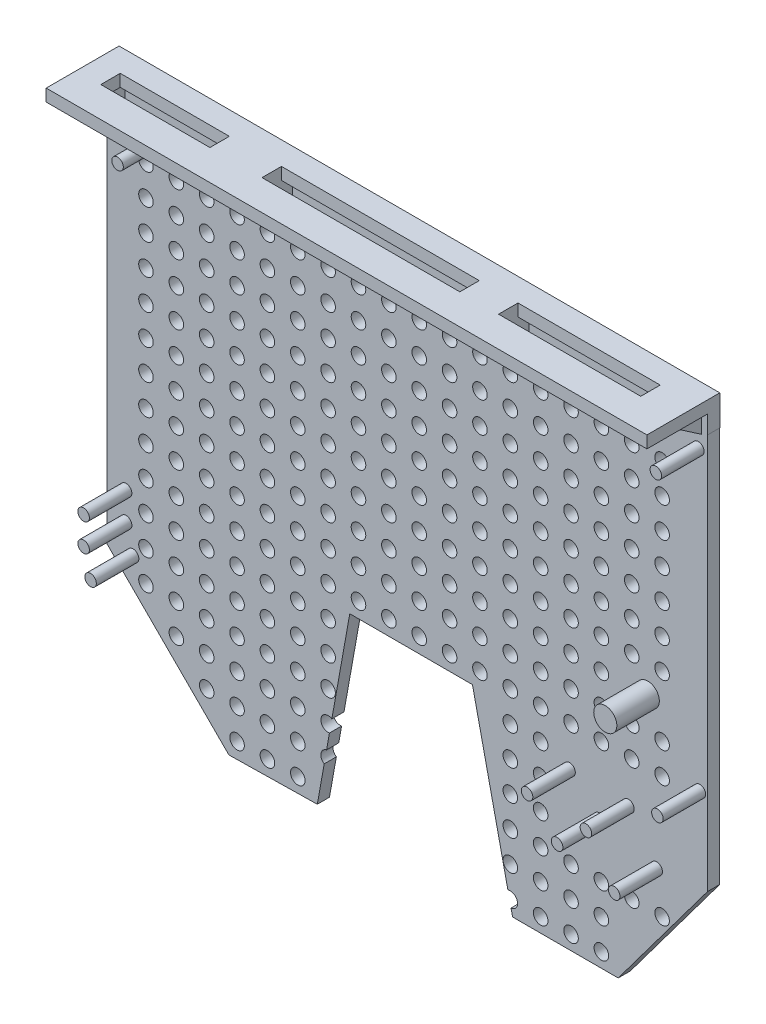
from build123d import *

# Parameters (mm, degrees)
EXTRUDE_1_DEPTH          = 2
SKETCH_2_R               = 0.95
SKETCH_2_R_2             = 1.9
EXTRUDE_2_DEPTH          = 9
SKETCH_3_W               = 98.928997638
SKETCH_3_H               = 5
EXTRUDE_3_DEPTH          = 2
SKETCH_4_W               = 98.928997638
SKETCH_4_H               = 2
EXTRUDE_4_DEPTH          = 12
CUT_EXTRUDE_3_REACH      = 116.614
SKETCH_6_W               = 32.578502253
SKETCH_6_H               = 3.2
SKETCH_6_W_2             = 23.419421548
SKETCH_6_W_3             = 17.970348218
CUT_EXTRUDE_6_DEPTH      = 97.263459093
CUT_EXTRUDE_6_DEPTH_BACK = 97.263459093
SKETCH_8_R               = 1.2
RIB_11_REACH             = 121.052
SKETCH_11_WALL_W         = 246.164501964
SKETCH_11_WALL_H         = 3
RIB_13_REACH             = 97.201
SKETCH_12_WALL_W         = 198.463511168
SKETCH_12_WALL_H         = 7
RIB_14_REACH             = 98.001
SKETCH_13_WALL_W         = 200.062147334
SKETCH_13_WALL_H         = 6
RIB_33_REACH             = 116.104
SKETCH_15_WALL_W         = 236.268757542
SKETCH_15_WALL_H         = 5


with BuildPart() as part:
    # 草图1 → 凸台-拉伸1 (new body)
    with BuildSketch(Plane.XY):
        Polygon((-29.070358141, -45.048209124), (-8.984674058, -65.133893207), (5.577379704, -64.884429769), (10.922021844, -35.039370079), (31.127475009, -35.049384298), (37.731775464, -64.884429769), (55.12709051, -64.88814952), (69.839329163, -45.20535212), (69.839329163, 19.933959868), (-29.070358141, 19.933959868), align=None)
    extrude(amount=EXTRUDE_1_DEPTH)

    # 草图2 → 凸台-拉伸2 (add)
    with BuildSketch(Plane.XY):
        with Locations(Location((-20.32004064, 17.018034036, 0), (0, 0, 180))):
            Circle(SKETCH_2_R)
        with Locations(Location((68.326136652, 17.272034544, 0), (0, 0, 180))):
            Circle(SKETCH_2_R)
        with Locations(Location((60.00011938, -22.00004318, 0), (0, 0, 180))):
            Circle(SKETCH_2_R_2)
        with Locations(Location((68.58013716, -31.496062992, 0), (0, 0, 180))):
            Circle(SKETCH_2_R)
        with Locations(Location((-25.908051816, -35.814071628, 0), (0, 0, 180))):
            Circle(SKETCH_2_R)
        with Locations(Location((-25.908051816, -40.386080772, 0), (0, 0, 180))):
            Circle(SKETCH_2_R)
        with Locations(Location((-24.76504953, -44.577089154, 0), (0, 0, 180))):
            Circle(SKETCH_2_R)
        with Locations(Location((56.811457963, -39.497078994, 0), (0, 0, 180))):
            Circle(SKETCH_2_R)
        with Locations(Location((47.117094234, -39.116078232, 0), (0, 0, 180))):
            Circle(SKETCH_2_R)
        with Locations(Location((52.07010414, -43.81508763, 0), (0, 0, 180))):
            Circle(SKETCH_2_R)
        with Locations(Location((61.468122936, -46.101092202, 0), (0, 0, 180))):
            Circle(SKETCH_2_R)
    extrude(amount=EXTRUDE_2_DEPTH)

    # 草图3 → 凸台-拉伸3 (add)
    with BuildSketch(Plane.XY):
        with Locations((20.394140678, 22.433959868)):
            Rectangle(SKETCH_3_W, SKETCH_3_H)
    extrude(amount=EXTRUDE_3_DEPTH)

    # 草图4 → 凸台-拉伸4 (add)
    with BuildSketch(Plane.XY):
        with Locations((20.394140678, 23.933959868)):
            Rectangle(SKETCH_4_W, SKETCH_4_H)
    extrude(amount=EXTRUDE_4_DEPTH)

    # 草图6 → 切除-拉伸3 (cut, up to next)
    with BuildSketch(Plane(origin=(0, 24.933959868, 0), x_dir=(1, 0, 0), z_dir=(0, 1, 0)), mode=Mode.PRIVATE) as cut_extrude_3_sk1:
        with Locations((17.760055682, -5.4)):
            Rectangle(SKETCH_6_W, SKETCH_6_H)
    cut_extrude_3_tool1 = extrude(cut_extrude_3_sk1.sketch, amount=-CUT_EXTRUDE_3_REACH, mode=Mode.PRIVATE) & part.part
    # 草图6 → 切除-拉伸3 (cut, up to next)
    with BuildSketch(Plane(origin=(0, 24.933959868, 0), x_dir=(1, 0, 0), z_dir=(0, 1, 0)), mode=Mode.PRIVATE) as cut_extrude_3_sk2:
        with Locations((52.135592757, -5.4)):
            Rectangle(SKETCH_6_W_2, SKETCH_6_H)
    cut_extrude_3_tool2 = extrude(cut_extrude_3_sk2.sketch, amount=-CUT_EXTRUDE_3_REACH, mode=Mode.PRIVATE) & part.part
    # 草图6 → 切除-拉伸3 (cut, up to next)
    with BuildSketch(Plane(origin=(0, 24.933959868, 0), x_dir=(1, 0, 0), z_dir=(0, 1, 0)), mode=Mode.PRIVATE) as cut_extrude_3_sk3:
        with Locations((-16.093761605, -5.4)):
            Rectangle(SKETCH_6_W_3, SKETCH_6_H)
    cut_extrude_3_tool3 = extrude(cut_extrude_3_sk3.sketch, amount=-CUT_EXTRUDE_3_REACH, mode=Mode.PRIVATE) & part.part
    add(cut_extrude_3_tool1.solids().sort_by_distance((17.760056, 24.93396, 5.4))[0], mode=Mode.SUBTRACT)
    add(cut_extrude_3_tool2.solids().sort_by_distance((52.135593, 24.93396, 5.4))[0], mode=Mode.SUBTRACT)
    add(cut_extrude_3_tool3.solids().sort_by_distance((-16.093762, 24.93396, 5.4))[0], mode=Mode.SUBTRACT)

    # 草图8 → 切除-拉伸6 (cut, two sides: drawn at the far end of the back side and taken through both)
    with BuildSketch(Plane.XY.offset(-CUT_EXTRUDE_6_DEPTH_BACK)):
        with Locations((-12.641748506, 17.458409182)):
            Circle(SKETCH_8_R)
        with Locations((-7.641748506, 17.458409182)):
            Circle(SKETCH_8_R)
        with Locations((-2.641748506, 17.458409182)):
            Circle(SKETCH_8_R)
        with Locations((2.358251494, 17.458409182)):
            Circle(SKETCH_8_R)
        with Locations((7.358251494, 17.458409182)):
            Circle(SKETCH_8_R)
        with Locations((12.358251494, 17.458409182)):
            Circle(SKETCH_8_R)
        with Locations((17.358251494, 17.458409182)):
            Circle(SKETCH_8_R)
        with Locations((22.358251494, 17.458409182)):
            Circle(SKETCH_8_R)
        with Locations((27.358251494, 17.458409182)):
            Circle(SKETCH_8_R)
        with Locations((32.358251494, 17.458409182)):
            Circle(SKETCH_8_R)
        with Locations((37.358251494, 17.458409182)):
            Circle(SKETCH_8_R)
        with Locations((42.358251494, 17.458409182)):
            Circle(SKETCH_8_R)
        with Locations((47.358251494, 17.458409182)):
            Circle(SKETCH_8_R)
        with Locations((52.358251494, 17.458409182)):
            Circle(SKETCH_8_R)
        with Locations((57.358251494, 17.458409182)):
            Circle(SKETCH_8_R)
        with Locations((62.358251494, 17.458409182)):
            Circle(SKETCH_8_R)
        with Locations((-17.641748506, 12.458409182)):
            Circle(SKETCH_8_R)
        with Locations((-12.641748506, 12.458409182)):
            Circle(SKETCH_8_R)
        with Locations((-7.641748506, 12.458409182)):
            Circle(SKETCH_8_R)
        with Locations((-2.641748506, 12.458409182)):
            Circle(SKETCH_8_R)
        with Locations((2.358251494, 12.458409182)):
            Circle(SKETCH_8_R)
        with Locations((7.358251494, 12.458409182)):
            Circle(SKETCH_8_R)
        with Locations((12.358251494, 12.458409182)):
            Circle(SKETCH_8_R)
        with Locations((17.358251494, 12.458409182)):
            Circle(SKETCH_8_R)
        with Locations((22.358251494, 12.458409182)):
            Circle(SKETCH_8_R)
        with Locations((27.358251494, 12.458409182)):
            Circle(SKETCH_8_R)
        with Locations((32.358251494, 12.458409182)):
            Circle(SKETCH_8_R)
        with Locations((37.358251494, 12.458409182)):
            Circle(SKETCH_8_R)
        with Locations((42.358251494, 12.458409182)):
            Circle(SKETCH_8_R)
        with Locations((47.358251494, 12.458409182)):
            Circle(SKETCH_8_R)
        with Locations((52.358251494, 12.458409182)):
            Circle(SKETCH_8_R)
        with Locations((57.358251494, 12.458409182)):
            Circle(SKETCH_8_R)
        with Locations((62.358251494, 12.458409182)):
            Circle(SKETCH_8_R)
        with Locations((-17.641748506, 7.458409182)):
            Circle(SKETCH_8_R)
        with Locations((-12.641748506, 7.458409182)):
            Circle(SKETCH_8_R)
        with Locations((-7.641748506, 7.458409182)):
            Circle(SKETCH_8_R)
        with Locations((-2.641748506, 7.458409182)):
            Circle(SKETCH_8_R)
        with Locations((2.358251494, 7.458409182)):
            Circle(SKETCH_8_R)
        with Locations((7.358251494, 7.458409182)):
            Circle(SKETCH_8_R)
        with Locations((12.358251494, 7.458409182)):
            Circle(SKETCH_8_R)
        with Locations((17.358251494, 7.458409182)):
            Circle(SKETCH_8_R)
        with Locations((22.358251494, 7.458409182)):
            Circle(SKETCH_8_R)
        with Locations((27.358251494, 7.458409182)):
            Circle(SKETCH_8_R)
        with Locations((32.358251494, 7.458409182)):
            Circle(SKETCH_8_R)
        with Locations((37.358251494, 7.458409182)):
            Circle(SKETCH_8_R)
        with Locations((42.358251494, 7.458409182)):
            Circle(SKETCH_8_R)
        with Locations((47.358251494, 7.458409182)):
            Circle(SKETCH_8_R)
        with Locations((52.358251494, 7.458409182)):
            Circle(SKETCH_8_R)
        with Locations((57.358251494, 7.458409182)):
            Circle(SKETCH_8_R)
        with Locations((62.358251494, 7.458409182)):
            Circle(SKETCH_8_R)
        with Locations((-17.641748506, 2.458409182)):
            Circle(SKETCH_8_R)
        with Locations((-12.641748506, 2.458409182)):
            Circle(SKETCH_8_R)
        with Locations((-7.641748506, 2.458409182)):
            Circle(SKETCH_8_R)
        with Locations((-2.641748506, 2.458409182)):
            Circle(SKETCH_8_R)
        with Locations((2.358251494, 2.458409182)):
            Circle(SKETCH_8_R)
        with Locations((7.358251494, 2.458409182)):
            Circle(SKETCH_8_R)
        with Locations((12.358251494, 2.458409182)):
            Circle(SKETCH_8_R)
        with Locations((17.358251494, 2.458409182)):
            Circle(SKETCH_8_R)
        with Locations((22.358251494, 2.458409182)):
            Circle(SKETCH_8_R)
        with Locations((27.358251494, 2.458409182)):
            Circle(SKETCH_8_R)
        with Locations((32.358251494, 2.458409182)):
            Circle(SKETCH_8_R)
        with Locations((37.358251494, 2.458409182)):
            Circle(SKETCH_8_R)
        with Locations((42.358251494, 2.458409182)):
            Circle(SKETCH_8_R)
        with Locations((47.358251494, 2.458409182)):
            Circle(SKETCH_8_R)
        with Locations((52.358251494, 2.458409182)):
            Circle(SKETCH_8_R)
        with Locations((57.358251494, 2.458409182)):
            Circle(SKETCH_8_R)
        with Locations((62.358251494, 2.458409182)):
            Circle(SKETCH_8_R)
        with Locations((-17.641748506, -2.541590818)):
            Circle(SKETCH_8_R)
        with Locations((-12.641748506, -2.541590818)):
            Circle(SKETCH_8_R)
        with Locations((-7.641748506, -2.541590818)):
            Circle(SKETCH_8_R)
        with Locations((-2.641748506, -2.541590818)):
            Circle(SKETCH_8_R)
        with Locations((2.358251494, -2.541590818)):
            Circle(SKETCH_8_R)
        with Locations((7.358251494, -2.541590818)):
            Circle(SKETCH_8_R)
        with Locations((12.358251494, -2.541590818)):
            Circle(SKETCH_8_R)
        with Locations((17.358251494, -2.541590818)):
            Circle(SKETCH_8_R)
        with Locations((22.358251494, -2.541590818)):
            Circle(SKETCH_8_R)
        with Locations((27.358251494, -2.541590818)):
            Circle(SKETCH_8_R)
        with Locations((32.358251494, -2.541590818)):
            Circle(SKETCH_8_R)
        with Locations((37.358251494, -2.541590818)):
            Circle(SKETCH_8_R)
        with Locations((42.358251494, -2.541590818)):
            Circle(SKETCH_8_R)
        with Locations((47.358251494, -2.541590818)):
            Circle(SKETCH_8_R)
        with Locations((52.358251494, -2.541590818)):
            Circle(SKETCH_8_R)
        with Locations((57.358251494, -2.541590818)):
            Circle(SKETCH_8_R)
        with Locations((62.358251494, -2.541590818)):
            Circle(SKETCH_8_R)
        with Locations((-17.641748506, -7.541590818)):
            Circle(SKETCH_8_R)
        with Locations((-12.641748506, -7.541590818)):
            Circle(SKETCH_8_R)
        with Locations((-7.641748506, -7.541590818)):
            Circle(SKETCH_8_R)
        with Locations((-2.641748506, -7.541590818)):
            Circle(SKETCH_8_R)
        with Locations((2.358251494, -7.541590818)):
            Circle(SKETCH_8_R)
        with Locations((7.358251494, -7.541590818)):
            Circle(SKETCH_8_R)
        with Locations((12.358251494, -7.541590818)):
            Circle(SKETCH_8_R)
        with Locations((17.358251494, -7.541590818)):
            Circle(SKETCH_8_R)
        with Locations((22.358251494, -7.541590818)):
            Circle(SKETCH_8_R)
        with Locations((27.358251494, -7.541590818)):
            Circle(SKETCH_8_R)
        with Locations((32.358251494, -7.541590818)):
            Circle(SKETCH_8_R)
        with Locations((37.358251494, -7.541590818)):
            Circle(SKETCH_8_R)
        with Locations((42.358251494, -7.541590818)):
            Circle(SKETCH_8_R)
        with Locations((47.358251494, -7.541590818)):
            Circle(SKETCH_8_R)
        with Locations((52.358251494, -7.541590818)):
            Circle(SKETCH_8_R)
        with Locations((57.358251494, -7.541590818)):
            Circle(SKETCH_8_R)
        with Locations((62.358251494, -7.541590818)):
            Circle(SKETCH_8_R)
        with Locations((-17.641748506, -12.541590818)):
            Circle(SKETCH_8_R)
        with Locations((-12.641748506, -12.541590818)):
            Circle(SKETCH_8_R)
        with Locations((-7.641748506, -12.541590818)):
            Circle(SKETCH_8_R)
        with Locations((-2.641748506, -12.541590818)):
            Circle(SKETCH_8_R)
        with Locations((2.358251494, -12.541590818)):
            Circle(SKETCH_8_R)
        with Locations((7.358251494, -12.541590818)):
            Circle(SKETCH_8_R)
        with Locations((12.358251494, -12.541590818)):
            Circle(SKETCH_8_R)
        with Locations((17.358251494, -12.541590818)):
            Circle(SKETCH_8_R)
        with Locations((22.358251494, -12.541590818)):
            Circle(SKETCH_8_R)
        with Locations((27.358251494, -12.541590818)):
            Circle(SKETCH_8_R)
        with Locations((32.358251494, -12.541590818)):
            Circle(SKETCH_8_R)
        with Locations((37.358251494, -12.541590818)):
            Circle(SKETCH_8_R)
        with Locations((42.358251494, -12.541590818)):
            Circle(SKETCH_8_R)
        with Locations((47.358251494, -12.541590818)):
            Circle(SKETCH_8_R)
        with Locations((52.358251494, -12.541590818)):
            Circle(SKETCH_8_R)
        with Locations((57.358251494, -12.541590818)):
            Circle(SKETCH_8_R)
        with Locations((62.358251494, -12.541590818)):
            Circle(SKETCH_8_R)
        with Locations((-17.641748506, -17.541590818)):
            Circle(SKETCH_8_R)
        with Locations((-12.641748506, -17.541590818)):
            Circle(SKETCH_8_R)
        with Locations((-7.641748506, -17.541590818)):
            Circle(SKETCH_8_R)
        with Locations((-2.641748506, -17.541590818)):
            Circle(SKETCH_8_R)
        with Locations((2.358251494, -17.541590818)):
            Circle(SKETCH_8_R)
        with Locations((7.358251494, -17.541590818)):
            Circle(SKETCH_8_R)
        with Locations((12.358251494, -17.541590818)):
            Circle(SKETCH_8_R)
        with Locations((17.358251494, -17.541590818)):
            Circle(SKETCH_8_R)
        with Locations((22.358251494, -17.541590818)):
            Circle(SKETCH_8_R)
        with Locations((27.358251494, -17.541590818)):
            Circle(SKETCH_8_R)
        with Locations((32.358251494, -17.541590818)):
            Circle(SKETCH_8_R)
        with Locations((37.358251494, -17.541590818)):
            Circle(SKETCH_8_R)
        with Locations((42.358251494, -17.541590818)):
            Circle(SKETCH_8_R)
        with Locations((47.358251494, -17.541590818)):
            Circle(SKETCH_8_R)
        with Locations((52.358251494, -17.541590818)):
            Circle(SKETCH_8_R)
        with Locations((57.358251494, -17.541590818)):
            Circle(SKETCH_8_R)
        with Locations((62.358251494, -17.541590818)):
            Circle(SKETCH_8_R)
        with Locations((-17.641748506, -22.541590818)):
            Circle(SKETCH_8_R)
        with Locations((-12.641748506, -22.541590818)):
            Circle(SKETCH_8_R)
        with Locations((-7.641748506, -22.541590818)):
            Circle(SKETCH_8_R)
        with Locations((-2.641748506, -22.541590818)):
            Circle(SKETCH_8_R)
        with Locations((2.358251494, -22.541590818)):
            Circle(SKETCH_8_R)
        with Locations((7.358251494, -22.541590818)):
            Circle(SKETCH_8_R)
        with Locations((12.358251494, -22.541590818)):
            Circle(SKETCH_8_R)
        with Locations((17.358251494, -22.541590818)):
            Circle(SKETCH_8_R)
        with Locations((22.358251494, -22.541590818)):
            Circle(SKETCH_8_R)
        with Locations((27.358251494, -22.541590818)):
            Circle(SKETCH_8_R)
        with Locations((32.358251494, -22.541590818)):
            Circle(SKETCH_8_R)
        with Locations((37.358251494, -22.541590818)):
            Circle(SKETCH_8_R)
        with Locations((42.358251494, -22.541590818)):
            Circle(SKETCH_8_R)
        with Locations((47.358251494, -22.541590818)):
            Circle(SKETCH_8_R)
        with Locations((52.358251494, -22.541590818)):
            Circle(SKETCH_8_R)
        with Locations((-17.641748506, -27.541590818)):
            Circle(SKETCH_8_R)
        with Locations((-12.641748506, -27.541590818)):
            Circle(SKETCH_8_R)
        with Locations((-7.641748506, -27.541590818)):
            Circle(SKETCH_8_R)
        with Locations((-2.641748506, -27.541590818)):
            Circle(SKETCH_8_R)
        with Locations((2.358251494, -27.541590818)):
            Circle(SKETCH_8_R)
        with Locations((7.358251494, -27.541590818)):
            Circle(SKETCH_8_R)
        with Locations((12.358251494, -27.541590818)):
            Circle(SKETCH_8_R)
        with Locations((17.358251494, -27.541590818)):
            Circle(SKETCH_8_R)
        with Locations((22.358251494, -27.541590818)):
            Circle(SKETCH_8_R)
        with Locations((27.358251494, -27.541590818)):
            Circle(SKETCH_8_R)
        with Locations((32.358251494, -27.541590818)):
            Circle(SKETCH_8_R)
        with Locations((37.358251494, -27.541590818)):
            Circle(SKETCH_8_R)
        with Locations((42.358251494, -27.541590818)):
            Circle(SKETCH_8_R)
        with Locations((47.358251494, -27.541590818)):
            Circle(SKETCH_8_R)
        with Locations((52.358251494, -27.541590818)):
            Circle(SKETCH_8_R)
        with Locations((57.358251494, -27.541590818)):
            Circle(SKETCH_8_R)
        with Locations((62.358251494, -27.541590818)):
            Circle(SKETCH_8_R)
        with Locations((-17.641748506, -32.541590818)):
            Circle(SKETCH_8_R)
        with Locations((-12.641748506, -32.541590818)):
            Circle(SKETCH_8_R)
        with Locations((-7.641748506, -32.541590818)):
            Circle(SKETCH_8_R)
        with Locations((-2.641748506, -32.541590818)):
            Circle(SKETCH_8_R)
        with Locations((2.358251494, -32.541590818)):
            Circle(SKETCH_8_R)
        with Locations((7.358251494, -32.541590818)):
            Circle(SKETCH_8_R)
        with Locations((12.358251494, -32.541590818)):
            Circle(SKETCH_8_R)
        with Locations((17.358251494, -32.541590818)):
            Circle(SKETCH_8_R)
        with Locations((22.358251494, -32.541590818)):
            Circle(SKETCH_8_R)
        with Locations((27.358251494, -32.541590818)):
            Circle(SKETCH_8_R)
        with Locations((32.358251494, -32.541590818)):
            Circle(SKETCH_8_R)
        with Locations((37.358251494, -32.541590818)):
            Circle(SKETCH_8_R)
        with Locations((42.358251494, -32.541590818)):
            Circle(SKETCH_8_R)
        with Locations((47.358251494, -32.541590818)):
            Circle(SKETCH_8_R)
        with Locations((52.358251494, -32.541590818)):
            Circle(SKETCH_8_R)
        with Locations((57.358251494, -32.541590818)):
            Circle(SKETCH_8_R)
        with Locations((62.358251494, -32.541590818)):
            Circle(SKETCH_8_R)
        with Locations((-17.641748506, -37.541590818)):
            Circle(SKETCH_8_R)
        with Locations((-12.641748506, -37.541590818)):
            Circle(SKETCH_8_R)
        with Locations((-7.641748506, -37.541590818)):
            Circle(SKETCH_8_R)
        with Locations((-2.641748506, -37.541590818)):
            Circle(SKETCH_8_R)
        with Locations((2.358251494, -37.541590818)):
            Circle(SKETCH_8_R)
        with Locations((7.358251494, -37.541590818)):
            Circle(SKETCH_8_R)
        with Locations((37.358251494, -37.541590818)):
            Circle(SKETCH_8_R)
        with Locations((42.358251494, -37.541590818)):
            Circle(SKETCH_8_R)
        with Locations((-17.641748506, -42.541590818)):
            Circle(SKETCH_8_R)
        with Locations((-12.641748506, -42.541590818)):
            Circle(SKETCH_8_R)
        with Locations((-7.641748506, -42.541590818)):
            Circle(SKETCH_8_R)
        with Locations((-2.641748506, -42.541590818)):
            Circle(SKETCH_8_R)
        with Locations((2.358251494, -42.541590818)):
            Circle(SKETCH_8_R)
        with Locations((7.358251494, -42.541590818)):
            Circle(SKETCH_8_R)
        with Locations((37.358251494, -42.541590818)):
            Circle(SKETCH_8_R)
        with Locations((42.358251494, -42.541590818)):
            Circle(SKETCH_8_R)
        with Locations((-17.641748506, -47.541590818)):
            Circle(SKETCH_8_R)
        with Locations((-12.641748506, -47.541590818)):
            Circle(SKETCH_8_R)
        with Locations((-7.641748506, -47.541590818)):
            Circle(SKETCH_8_R)
        with Locations((-2.641748506, -47.541590818)):
            Circle(SKETCH_8_R)
        with Locations((2.358251494, -47.541590818)):
            Circle(SKETCH_8_R)
        with Locations((7.358251494, -47.541590818)):
            Circle(SKETCH_8_R)
        with Locations((37.358251494, -47.541590818)):
            Circle(SKETCH_8_R)
        with Locations((42.358251494, -47.541590818)):
            Circle(SKETCH_8_R)
        with Locations((-17.641748506, -52.541590818)):
            Circle(SKETCH_8_R)
        with Locations((-12.641748506, -52.541590818)):
            Circle(SKETCH_8_R)
        with Locations((-7.641748506, -52.541590818)):
            Circle(SKETCH_8_R)
        with Locations((-2.641748506, -52.541590818)):
            Circle(SKETCH_8_R)
        with Locations((2.358251494, -52.541590818)):
            Circle(SKETCH_8_R)
        with Locations((7.358251494, -52.541590818)):
            Circle(SKETCH_8_R)
        with Locations((37.358251494, -52.541590818)):
            Circle(SKETCH_8_R)
        with Locations((42.358251494, -52.541590818)):
            Circle(SKETCH_8_R)
        with Locations((47.358251494, -52.541590818)):
            Circle(SKETCH_8_R)
        with Locations((52.358251494, -52.541590818)):
            Circle(SKETCH_8_R)
        with Locations((57.358251494, -52.541590818)):
            Circle(SKETCH_8_R)
        with Locations((62.358251494, -52.541590818)):
            Circle(SKETCH_8_R)
        with Locations((-12.641748506, -57.541590818)):
            Circle(SKETCH_8_R)
        with Locations((-7.641748506, -57.541590818)):
            Circle(SKETCH_8_R)
        with Locations((-2.641748506, -57.541590818)):
            Circle(SKETCH_8_R)
        with Locations((2.358251494, -57.541590818)):
            Circle(SKETCH_8_R)
        with Locations((7.358251494, -57.541590818)):
            Circle(SKETCH_8_R)
        with Locations((37.358251494, -57.541590818)):
            Circle(SKETCH_8_R)
        with Locations((42.358251494, -57.541590818)):
            Circle(SKETCH_8_R)
        with Locations((47.358251494, -57.541590818)):
            Circle(SKETCH_8_R)
        with Locations((52.358251494, -57.541590818)):
            Circle(SKETCH_8_R)
        with Locations((-7.641748506, -62.541590818)):
            Circle(SKETCH_8_R)
        with Locations((-2.641748506, -62.541590818)):
            Circle(SKETCH_8_R)
        with Locations((2.358251494, -62.541590818)):
            Circle(SKETCH_8_R)
        with Locations((7.358251494, -62.541590818)):
            Circle(SKETCH_8_R)
        with Locations((37.358251494, -62.541590818)):
            Circle(SKETCH_8_R)
        with Locations((42.358251494, -62.541590818)):
            Circle(SKETCH_8_R)
        with Locations((47.358251494, -62.541590818)):
            Circle(SKETCH_8_R)
        with Locations((52.358251494, -62.541590818)):
            Circle(SKETCH_8_R)
        with Locations((-22.641748506, 12.458409182)):
            Circle(SKETCH_8_R)
        with Locations((-22.641748506, 7.458409182)):
            Circle(SKETCH_8_R)
        with Locations((-22.641748506, 2.458409182)):
            Circle(SKETCH_8_R)
        with Locations((-22.641748506, -2.541590818)):
            Circle(SKETCH_8_R)
        with Locations((-22.641748506, -7.541590818)):
            Circle(SKETCH_8_R)
        with Locations((-22.641748506, -12.541590818)):
            Circle(SKETCH_8_R)
        with Locations((-22.641748506, -17.541590818)):
            Circle(SKETCH_8_R)
        with Locations((-22.641748506, -22.541590818)):
            Circle(SKETCH_8_R)
        with Locations((-22.641748506, -27.541590818)):
            Circle(SKETCH_8_R)
        with Locations((-22.641748506, -32.541590818)):
            Circle(SKETCH_8_R)
        with Locations((-22.641748506, -37.541590818)):
            Circle(SKETCH_8_R)
        with Locations((-22.641748506, -42.541590818)):
            Circle(SKETCH_8_R)
        with Locations((-22.641748506, -47.541590818)):
            Circle(SKETCH_8_R)
    extrude(amount=CUT_EXTRUDE_6_DEPTH + CUT_EXTRUDE_6_DEPTH_BACK, mode=Mode.SUBTRACT)

    # 草图11 wall → 筋11 (add, up to next)
    with BuildSketch(Plane(origin=(-29.070358141, 21.221468456, 4.5), x_dir=(0, -0.565125539075, -0.82500492428), z_dir=(0, -0.82500492428, 0.565125539075)), mode=Mode.PRIVATE) as rib_11_sk1:
        with Locations((0, 1.5)):
            Rectangle(SKETCH_11_WALL_W, SKETCH_11_WALL_H)
    rib_11_tool1 = extrude(rib_11_sk1.sketch, amount=-RIB_11_REACH, mode=Mode.PRIVATE) - part.part
    add(rib_11_tool1.solids().sort_by_distance((-29.070358141, 21.221468456, 4.5))[0])

    # 草图12 wall → 筋13 (add, up to next)
    with BuildSketch(Plane(origin=(1.470804556, 21.221468456, 4.5), x_dir=(0, -0.565125539075, -0.82500492428), z_dir=(0, -0.82500492428, 0.565125539075)), mode=Mode.PRIVATE) as rib_13_sk1:
        with Locations((0, -3.5)):
            Rectangle(SKETCH_12_WALL_W, SKETCH_12_WALL_H)
    rib_13_tool1 = extrude(rib_13_sk1.sketch, amount=-RIB_13_REACH, mode=Mode.PRIVATE) - part.part
    add(rib_13_tool1.solids().sort_by_distance((1.470804556, 21.221468456, 4.5))[0])

    # 草图13 wall → 筋14 (add, up to next)
    with BuildSketch(Plane(origin=(40.425881983, 21.221468456, 4.5), x_dir=(0, -0.565125539075, -0.82500492428), z_dir=(0, -0.82500492428, 0.565125539075)), mode=Mode.PRIVATE) as rib_14_sk1:
        with Locations((0, -3)):
            Rectangle(SKETCH_13_WALL_W, SKETCH_13_WALL_H)
    rib_14_tool1 = extrude(rib_14_sk1.sketch, amount=-RIB_14_REACH, mode=Mode.PRIVATE) - part.part
    add(rib_14_tool1.solids().sort_by_distance((40.425881983, 21.221468456, 4.5))[0])

    # 草图15 wall → 筋33 (add, up to next)
    with BuildSketch(Plane(origin=(63.845303531, 21.221468456, 4.5), x_dir=(0, -0.565125539075, -0.82500492428), z_dir=(0, -0.82500492428, 0.565125539075)), mode=Mode.PRIVATE) as rib_33_sk1:
        with Locations((0, 2.5)):
            Rectangle(SKETCH_15_WALL_W, SKETCH_15_WALL_H)
    rib_33_tool1 = extrude(rib_33_sk1.sketch, amount=-RIB_33_REACH, mode=Mode.PRIVATE) - part.part
    add(rib_33_tool1.solids().sort_by_distance((63.845303531, 21.221468456, 4.5))[0])


solid = part.part
